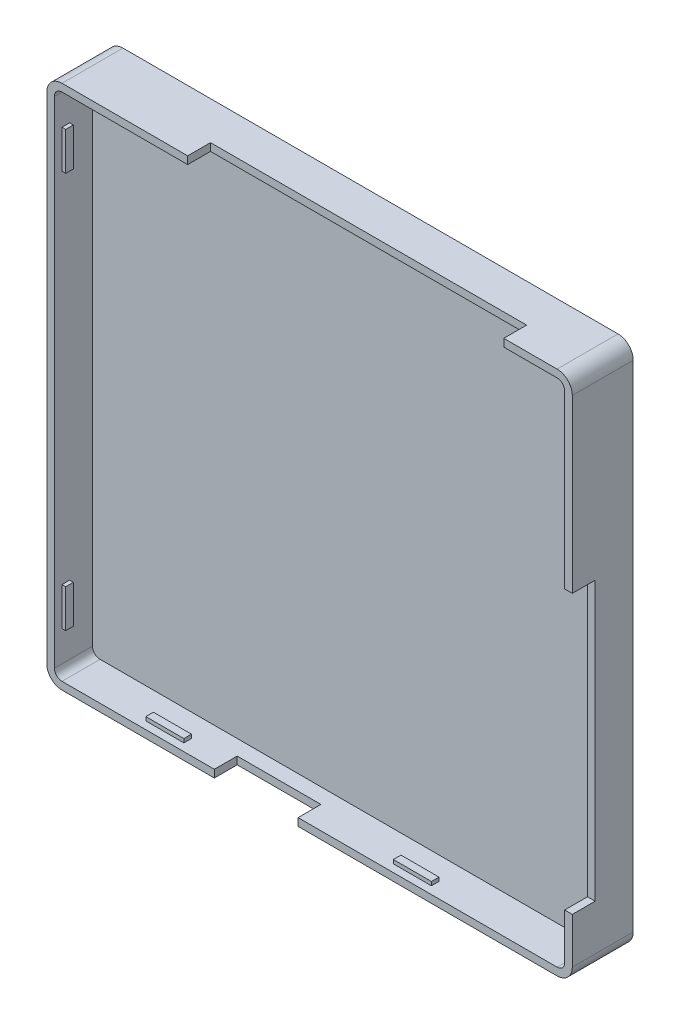
from build123d import *

# Parameters (mm, degrees)
BOSS_EXTRU_1_DEPTH      = 8
ENL_V_MAT_EXTRU_1_DEPTH = 5
ESQUISSE4_W             = 5
ESQUISSE4_H             = 1
BOSS_EXTRU_3_DEPTH      = 0.48904
ESQUISSE5_W             = 1
ESQUISSE5_H             = 5
BOSS_EXTRU_4_DEPTH      = 0.48904
ESQUISSE6_W             = 1
ESQUISSE6_H             = 5
BOSS_EXTRU_5_DEPTH      = 0.48904
ESQUISSE7_W             = 1
ESQUISSE7_H             = 5
BOSS_EXTRU_6_DEPTH      = 0.48904
ESQUISSE8_W             = 5
ESQUISSE8_H             = 1
BOSS_EXTRU_7_DEPTH      = 0.48904
ESQUISSE9_W             = 5
ESQUISSE9_H             = 1
BOSS_EXTRU_8_DEPTH      = 0.48904
ESQUISSE10_W            = 3
ESQUISSE10_H            = 36.5
ENL_V_MAT_EXTRU_3_DEPTH = 98.205966895
ESQUISSE11_W            = 41.5
ESQUISSE11_H            = 3
ENL_V_MAT_EXTRU_4_DEPTH = 98.205966895
ESQUISSE12_W            = 11
ESQUISSE12_H            = 3
ENL_V_MAT_EXTRU_5_DEPTH = 98.205966895


with BuildPart() as part:
    # Esquisse1 → Boss.-Extru.1 (new body)
    with BuildSketch(Plane.XY):
        with BuildLine():
            Line((2, 0), (67, 0))
            ThreePointArc((67, 0), (68.414213562, 0.585786438), (69, 2))
            Line((69, 2), (69, 67))
            ThreePointArc((69, 67), (68.414213562, 68.414213562), (67, 69))
            Line((67, 69), (2, 69))
            ThreePointArc((2, 69), (0.585786438, 68.414213562), (0, 67))
            Line((0, 67), (0, 2))
            ThreePointArc((0, 2), (0.585786438, 0.585786438), (2, 0))
        make_face()
    extrude(amount=BOSS_EXTRU_1_DEPTH)

    # Esquisse3 → Enlèv. mat.-Extru.1 (cut)
    with BuildSketch(Plane.XY.offset(8)):
        with BuildLine():
            Line((2, 1), (67, 1))
            ThreePointArc((67, 1), (67.707106781, 1.292893219), (68, 2))
            Line((68, 2), (68, 67))
            ThreePointArc((68, 67), (67.707106781, 67.707106781), (67, 68))
            Line((67, 68), (2, 68))
            ThreePointArc((2, 68), (1.292893219, 67.707106781), (1, 67))
            Line((1, 67), (1, 2))
            ThreePointArc((1, 2), (1.292893219, 1.292893219), (2, 1))
        make_face()
    extrude(amount=-ENL_V_MAT_EXTRU_1_DEPTH, mode=Mode.SUBTRACT)

    # Esquisse4 → Boss.-Extru.3 (add)
    with BuildSketch(Plane.XZ.offset(-68)):
        with Locations((10.679731729, 6.5)):
            Rectangle(ESQUISSE4_W, ESQUISSE4_H)
    extrude(amount=BOSS_EXTRU_3_DEPTH)

    # Esquisse5 → Boss.-Extru.4 (add)
    with BuildSketch(Plane.ZY.offset(-68)):
        with Locations((6.5, 61.5)):
            Rectangle(ESQUISSE5_W, ESQUISSE5_H)
    extrude(amount=BOSS_EXTRU_4_DEPTH)

    # Esquisse6 → Boss.-Extru.5 (add)
    with BuildSketch(Plane(origin=(1, 0, 0), x_dir=(0, 0, -1), z_dir=(1, 0, 0))):
        with Locations((-6.5, 60.5)):
            Rectangle(ESQUISSE6_W, ESQUISSE6_H)
    extrude(amount=BOSS_EXTRU_5_DEPTH)

    # Esquisse7 → Boss.-Extru.6 (add)
    with BuildSketch(Plane(origin=(1, 0, 0), x_dir=(0, 0, -1), z_dir=(1, 0, 0))):
        with Locations((-6.5, 8.5)):
            Rectangle(ESQUISSE7_W, ESQUISSE7_H)
    extrude(amount=BOSS_EXTRU_6_DEPTH)

    # Esquisse8 → Boss.-Extru.7 (add)
    with BuildSketch(Plane(origin=(0, 1, 0), x_dir=(1, 0, 0), z_dir=(0, 1, 0))):
        with Locations((14.5, -6.5)):
            Rectangle(ESQUISSE8_W, ESQUISSE8_H)
    extrude(amount=BOSS_EXTRU_7_DEPTH)

    # Esquisse9 → Boss.-Extru.8 (add)
    with BuildSketch(Plane(origin=(0, 1, 0), x_dir=(1, 0, 0), z_dir=(0, 1, 0))):
        with Locations((47, -6.5)):
            Rectangle(ESQUISSE9_W, ESQUISSE9_H)
    extrude(amount=BOSS_EXTRU_8_DEPTH)

    # Esquisse10 → Enlèv. mat.-Extru.3 (cut, through all)
    with BuildSketch(Plane.ZY.offset(-68)):
        with Locations((6.5, 26.25)):
            Rectangle(ESQUISSE10_W, ESQUISSE10_H)
    extrude(amount=-ENL_V_MAT_EXTRU_3_DEPTH, mode=Mode.SUBTRACT)

    # Esquisse11 → Enlèv. mat.-Extru.4 (cut, through all)
    with BuildSketch(Plane.XZ.offset(-68)):
        with Locations((39.25, 6.5)):
            Rectangle(ESQUISSE11_W, ESQUISSE11_H)
    extrude(amount=-ENL_V_MAT_EXTRU_4_DEPTH, mode=Mode.SUBTRACT)

    # Esquisse12 → Enlèv. mat.-Extru.5 (cut, through all)
    with BuildSketch(Plane(origin=(0, 1, 0), x_dir=(1, 0, 0), z_dir=(0, 1, 0))):
        with Locations((27.5, -6.5)):
            Rectangle(ESQUISSE12_W, ESQUISSE12_H)
    extrude(amount=-ENL_V_MAT_EXTRU_5_DEPTH, mode=Mode.SUBTRACT)


solid = part.part
